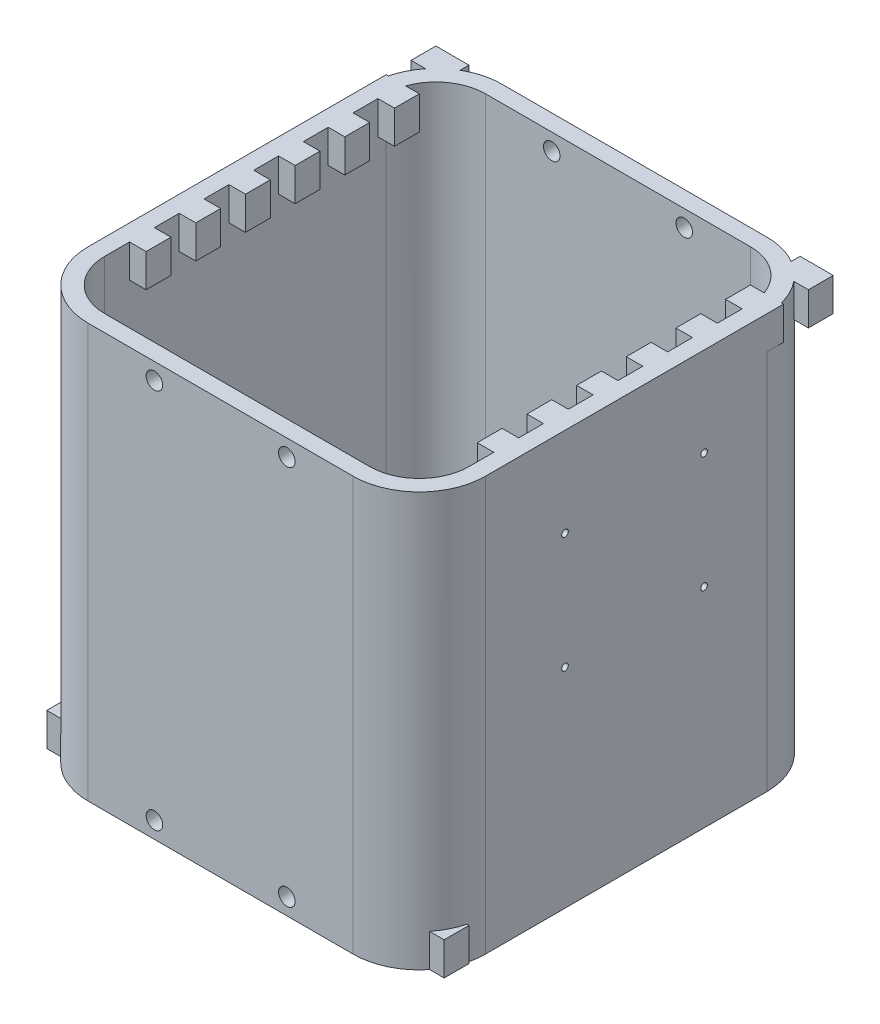
from build123d import *

# Parameters (mm, degrees)
BOSS_EXTRUDE1_DEPTH = 250
SKETCH3_W           = 15
SKETCH3_H           = 20
BOSS_EXTRUDE2_DEPTH = 20
SKETCH4_W           = 15
SKETCH4_H           = 20
BOSS_EXTRUDE3_DEPTH = 20
SKETCH8_W           = 15
SKETCH8_H           = 20
BOSS_EXTRUDE5_DEPTH = 20
SKETCH9_W           = 15
SKETCH9_H           = 20
BOSS_EXTRUDE6_DEPTH = 20
SKETCH11_R          = 2
CUT_EXTRUDE1_DEPTH  = 10
SKETCH12_R          = 5
CUT_EXTRUDE2_DEPTH  = 10
CUT_EXTRUDE3_START  = -10
SKETCH13_R          = 5
CUT_EXTRUDE3_DEPTH  = 10


with BuildPart() as part:
    # Sketch1 → Boss-Extrude1 (new body)
    with BuildSketch(Plane(origin=(0, 0, 0), x_dir=(1, 0, 0), z_dir=(0, 1, 0))):
        with BuildLine():
            Line((-10, 30), (-10, 200))
            ThreePointArc((-10, 200), (1.715728753, 228.284271247), (30, 240))
            Line((30, 240), (190, 240))
            ThreePointArc((190, 240), (218.284271247, 228.284271247), (230, 200))
            Line((230, 200), (230, 30))
            ThreePointArc((230, 30), (218.284271247, 1.715728753), (190, -10))
            Line((190, -10), (30, -10))
            ThreePointArc((30, -10), (1.715728753, 1.715728753), (-10, 30))
        make_face()
        with BuildLine():
            Line((30, 0), (190, 0))
            ThreePointArc((190, 0), (211.213203436, 8.786796564), (220, 30))
            Line((220, 30), (220, 200))
            ThreePointArc((220, 200), (211.213203436, 221.213203436), (190, 230))
            Line((190, 230), (30, 230))
            ThreePointArc((30, 230), (8.786796564, 221.213203436), (0, 200))
            Line((0, 200), (0, 30))
            ThreePointArc((0, 30), (8.786796564, 8.786796564), (30, 0))
        make_face(mode=Mode.SUBTRACT)
    extrude(amount=BOSS_EXTRUDE1_DEPTH)

    # Sketch3 → Boss-Extrude2 (add)
    with BuildSketch(Plane.ZY.offset(10)):
        with Locations((-192.5, 10)):
            Rectangle(SKETCH3_W, SKETCH3_H)
        with Locations((-162.5, 10)):
            Rectangle(SKETCH3_W, SKETCH3_H)
        with Locations((-132.5, 10)):
            Rectangle(SKETCH3_W, SKETCH3_H)
        with Locations((-102.5, 10)):
            Rectangle(SKETCH3_W, SKETCH3_H)
        with Locations((-72.5, 10)):
            Rectangle(SKETCH3_W, SKETCH3_H)
        with Locations((-42.5, 10)):
            Rectangle(SKETCH3_W, SKETCH3_H)
        with Locations((-12.5, 10)):
            Rectangle(SKETCH3_W, SKETCH3_H)
    extrude(amount=-BOSS_EXTRUDE2_DEPTH)

    # Sketch4 → Boss-Extrude3 (add)
    with BuildSketch(Plane(origin=(230, 0, 0), x_dir=(0, 0, -1), z_dir=(1, 0, 0))):
        with Locations((192.5, 10)):
            Rectangle(SKETCH4_W, SKETCH4_H)
        with Locations((162.5, 10)):
            Rectangle(SKETCH4_W, SKETCH4_H)
        with Locations((132.5, 10)):
            Rectangle(SKETCH4_W, SKETCH4_H)
        with Locations((102.5, 10)):
            Rectangle(SKETCH4_W, SKETCH4_H)
        with Locations((72.5, 10)):
            Rectangle(SKETCH4_W, SKETCH4_H)
        with Locations((42.5, 10)):
            Rectangle(SKETCH4_W, SKETCH4_H)
        with Locations((12.5, 10)):
            Rectangle(SKETCH4_W, SKETCH4_H)
    extrude(amount=-BOSS_EXTRUDE3_DEPTH)

    # Sketch8 → Boss-Extrude5 (add)
    with BuildSketch(Plane(origin=(-10, 0, 0), x_dir=(0, 0, -1), z_dir=(1, 0, 0))):
        with Locations((52.5, 240)):
            Rectangle(SKETCH8_W, SKETCH8_H)
        with Locations((82.5, 240)):
            Rectangle(SKETCH8_W, SKETCH8_H)
        with Locations((112.5, 240)):
            Rectangle(SKETCH8_W, SKETCH8_H)
        with Locations((142.5, 240)):
            Rectangle(SKETCH8_W, SKETCH8_H)
        with Locations((172.5, 240)):
            Rectangle(SKETCH8_W, SKETCH8_H)
        with Locations((202.5, 240)):
            Rectangle(SKETCH8_W, SKETCH8_H)
        with Locations((232.5, 240)):
            Rectangle(SKETCH8_W, SKETCH8_H)
    extrude(amount=BOSS_EXTRUDE5_DEPTH)

    # Sketch9 → Boss-Extrude6 (add)
    with BuildSketch(Plane(origin=(230, 0, 0), x_dir=(0, 0, -1), z_dir=(1, 0, 0))):
        with Locations((52.5, 240)):
            Rectangle(SKETCH9_W, SKETCH9_H)
        with Locations((82.5, 240)):
            Rectangle(SKETCH9_W, SKETCH9_H)
        with Locations((112.5, 240)):
            Rectangle(SKETCH9_W, SKETCH9_H)
        with Locations((142.5, 240)):
            Rectangle(SKETCH9_W, SKETCH9_H)
        with Locations((172.5, 240)):
            Rectangle(SKETCH9_W, SKETCH9_H)
        with Locations((202.5, 240)):
            Rectangle(SKETCH9_W, SKETCH9_H)
        with Locations((232.5, 240)):
            Rectangle(SKETCH9_W, SKETCH9_H)
    extrude(amount=-BOSS_EXTRUDE6_DEPTH)

    # Sketch11 → Cut-Extrude1 (cut)
    with BuildSketch(Plane(origin=(230, 0, 0), x_dir=(0, 0, -1), z_dir=(1, 0, 0))):
        with Locations((78, 196.104898216)):
            Circle(SKETCH11_R)
        with Locations((78, 126.104898216)):
            Circle(SKETCH11_R)
        with Locations((162, 126.104898216)):
            Circle(SKETCH11_R)
        with Locations((162, 196.104898216)):
            Circle(SKETCH11_R)
    extrude(amount=-CUT_EXTRUDE1_DEPTH, mode=Mode.SUBTRACT)

    # Sketch12 → Cut-Extrude2 (cut)
    with BuildSketch(Plane(origin=(0, 0, -240), x_dir=(-1, 0, 0), z_dir=(0, 0, -1))):
        with Locations((-150, 240)):
            Circle(SKETCH12_R)
        with Locations((-70, 240)):
            Circle(SKETCH12_R)
        with Locations((-70, 10)):
            Circle(SKETCH12_R)
        with Locations((-150, 10)):
            Circle(SKETCH12_R)
    extrude(amount=-CUT_EXTRUDE2_DEPTH, mode=Mode.SUBTRACT)

    # Sketch13 → Cut-Extrude3 (cut)
    with BuildSketch(Plane.XY.offset(10).offset(CUT_EXTRUDE3_START)):
        with Locations((70, 240)):
            Circle(SKETCH13_R)
        with Locations((150, 240)):
            Circle(SKETCH13_R)
        with Locations((150, 10)):
            Circle(SKETCH13_R)
        with Locations((70, 10)):
            Circle(SKETCH13_R)
    extrude(amount=CUT_EXTRUDE3_DEPTH, mode=Mode.SUBTRACT)


solid = part.part
